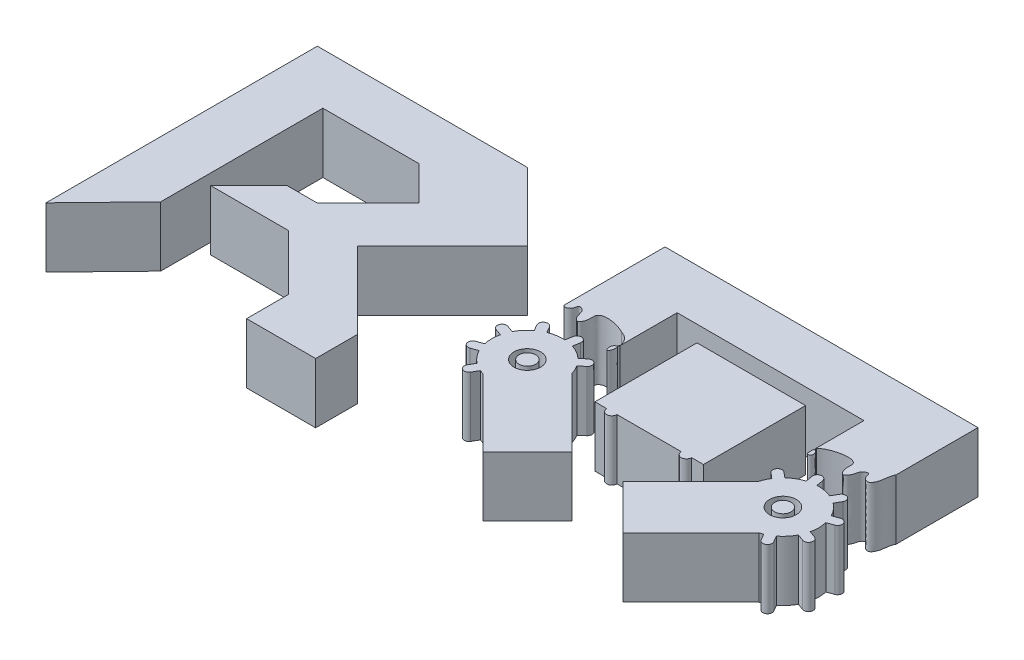
from build123d import *

# Parameters (mm, degrees)
BOSS_EXTRUDE1_DEPTH   = 10
BOSS_EXTRUDE1_2_DEPTH = 10
BOSS_EXTRUDE1_3_DEPTH = 10
BOSS_EXTRUDE1_4_DEPTH = 10
BOSS_EXTRUDE2_DEPTH   = 10
BOSS_EXTRUDE3_DEPTH   = 10
CUT_EXTRUDE1_DEPTH    = 10
BOSS_EXTRUDE5_DEPTH   = 10
BOSS_EXTRUDE6_DEPTH   = 10
CUT_EXTRUDE2_DEPTH    = 10
CUT_EXTRUDE3_DEPTH    = 10
BOSS_EXTRUDE7_DEPTH   = 10
BOSS_EXTRUDE7_2_DEPTH = 10
SKETCH12_R            = 2.214150269
SKETCH12_R_2          = 1.369548962
CUT_EXTRUDE4_DEPTH    = 10
SKETCH14_R            = 2.215
SKETCH14_R_2          = 1.37
CUT_EXTRUDE5_DEPTH    = 10


# Read off the part's stored shape, not the designer's step: Boss-Extrude3, Boss-Extrude5
with BuildPart() as part:
    # Sketch2 → Boss-Extrude1 (new body)
    with BuildSketch(Plane(origin=(0, 0, 0), x_dir=(1, 0, 0), z_dir=(0, 1, 0))):
        Polygon((-115.790051888, 9.714131272), (-80.790051888, 9.714131272), (-69.476343389, -1.599577227), (-83.618479013, -15.74171285), (-70.890556951, -28.469634912), (-70.890556951, -35.469634912), (-82.390556951, -35.469634912), (-82.390556951, -28.469634912), (-91.582945107, -19.277246756), (-104.582945107, -19.277246756), (-98.218984076, -12.913285726), (-93.218984076, -12.913285726), (-84.733702702, -4.428004351), (-90.390556951, 1.228849898), (-106.390556951, 1.228849898), (-106.390556951, -25.771150102), (-115.790051888, -35.469634912), align=None)
    extrude(amount=BOSS_EXTRUDE1_DEPTH)


with BuildPart() as body_2:
    # Sketch2 → Boss-Extrude1 2 (new body)
    with BuildSketch(Plane(origin=(0, 0, 0), x_dir=(1, 0, 0), z_dir=(0, 1, 0))):
        Polygon((-57.90275026, 9.714131272), (-57.90275026, -8.285868728), (-47.40275026, -8.285868728), (-47.40275026, 1.228849898), (-16.290051888, 1.228849898), (-16.290051888, -8.285868728), (-5.790051888, -8.285868728), (-5.790051888, 9.714131272), align=None)
    extrude(amount=BOSS_EXTRUDE1_2_DEPTH)

    # Sketch5 → Cut-Extrude1 (cut)
    with BuildSketch(Plane(origin=(0, 10, 0), x_dir=(1, 0, 0), z_dir=(0, 1, 0))):
        with BuildLine():
            Line((-16.290051888, -6.755516714), (-16.290051888, -8.285868728))
            Line((-16.290051888, -8.285868728), (-10.241204107, -8.285868728))
            add(Edge.make_bspline(
                [(-16.290051888, -6.755516714), (-15.086557725, -5.555520255), (-10.356708786, -4.539122293), (-11.112913844, -7.181843134), (-10.523034266, -8.273529149), (-10.241204107, -8.285868728)],
                knots=[0.102035434, 0.102035434, 0.102035434, 0.102035434, 0.361749054, 0.447111928, 0.509331686, 0.509331686, 0.509331686, 0.509331686], degree=3))
        make_face()
        with BuildLine():
            add(Edge.make_bspline(
                [(-10.217598425, -8.285868728), (-9.946495947, -8.274191318), (-9.288219588, -7.366460763), (-9.384527193, -6.374824783), (-8.082892219, -5.740250169), (-8.12682918, -6.978735964), (-7.012724749, -7.527990057), (-5.995137794, -6.005514134), (-6.254427822, -4.834059373), (-5.790051888, -3.907301253)],
                knots=[0.511063477, 0.511063477, 0.511063477, 0.511063477, 0.57055784, 0.643212518, 0.687880873, 0.734630546, 0.794154766, 0.839565267, 1, 1, 1, 1], degree=3))
            Line((-10.217598425, -8.285868728), (-5.790051888, -8.285868728))
            Line((-5.790051888, -8.285868728), (-5.790051888, -3.907301253))
        make_face()
    extrude(amount=-CUT_EXTRUDE1_DEPTH, mode=Mode.SUBTRACT)

    # Boss-Extrude5 outline → Boss-Extrude5 (add)
    with BuildSketch(Plane(origin=(0, 0, 0), x_dir=(1, 0, 0), z_dir=(0, 1, 0))):
        with BuildLine():
            Line((-16.290051888, -6.755516716), (-16.290051886, -6.718417146))
            add(Edge.make_bspline(
                [(-16.290051886, -6.718417146), (-16.29986079, -6.712492361), (-16.318900298, -6.706026413), (-16.300126293, -6.736175313), (-16.290051888, -6.755516716)],
                knots=[0.878523641, 0.878523641, 0.878523641, 0.878523641, 0.926519369, 1, 1, 1, 1], degree=3))
        make_face()
        with BuildLine():
            add(Edge.make_bspline(
                [(-16.290051889, -6.755516715), (-16.282897588, -6.748383207), (-16.27566002, -6.741265072), (-16.268340317, -6.734162607)],
                knots=[0.102035434, 0.102035434, 0.102035434, 0.102035434, 0.10357933, 0.10357933, 0.10357933, 0.10357933], degree=3))
            add(Edge.make_bspline(
                [(-16.290051889, -6.755516715), (-16.233648566, -6.863802945), (-16.217427394, -7.006707961), (-16.200258905, -7.001385989)],
                knots=[1, 1, 1, 1, 1.411394157, 1.411394157, 1.411394157, 1.411394157], degree=3))
            add(Edge.make_bspline(
                [(-16.19994332, -7.001270914), (-16.200048589, -7.00130913), (-16.200153786, -7.001347481), (-16.200258905, -7.001385989)],
                knots=[4.832e-06, 4.832e-06, 4.832e-06, 4.832e-06, 0.000153635, 0.000153635, 0.000153635, 0.000153635], degree=3))
            add(Edge.make_bspline(
                [(-16.19994332, -7.001270914), (-16.199939769, -7.001269997), (-16.182623673, -6.994039059), (-16.163283505, -6.828243372), (-16.264159765, -6.737651576), (-16.268340317, -6.734162607)],
                knots=[0.413915519, 0.413915519, 0.413915519, 0.413915519, 0.413995781, 0.828523269, 0.846360217, 0.846360217, 0.846360217, 0.846360217], degree=3))
        make_face()
    extrude(amount=BOSS_EXTRUDE5_DEPTH)

    # Sketch5<5> → Cut-Extrude2 (cut)
    with BuildSketch(Plane(origin=(0, 10, 0), x_dir=(1, 0, 0), z_dir=(0, 1, 0))):
        with BuildLine():
            add(Edge.make_bspline(
                [(-48.435448632, -8.285868728), (-46.372253699, -6.441223796), (-54.558235441, -3.877070611), (-53.612586676, -7.181843134), (-54.202466254, -8.273529149), (-54.484296413, -8.285868728)],
                knots=[0, 0, 0, 0, 0.361749054, 0.447111928, 0.509331686, 0.509331686, 0.509331686, 0.509331686], degree=3))
            Line((-54.484296413, -8.285868728), (-48.435448632, -8.285868728))
        make_face()
        with BuildLine():
            Line((-54.484296413, -8.285868728), (-54.507902095, -8.285868728))
            add(Edge.make_bspline(
                [(-54.484296413, -8.285868728), (-54.492140724, -8.286212181), (-54.500010709, -8.28620864), (-54.507902095, -8.285868728)],
                knots=[0.509331686, 0.509331686, 0.509331686, 0.509331686, 0.511063477, 0.511063477, 0.511063477, 0.511063477], degree=3))
        make_face()
        with BuildLine():
            Line((-57.90275026, -7.145951719), (-57.90275026, -8.285868728))
            Line((-57.90275026, -8.285868728), (-54.507902095, -8.285868728))
            add(Edge.make_bspline(
                [(-54.507902095, -8.285868728), (-54.779004573, -8.274191318), (-55.437280932, -7.366460763), (-55.340973326, -6.374824783), (-56.642608301, -5.740250169), (-56.598671339, -6.978735964), (-57.481588669, -7.41401469), (-57.84062135, -7.198771203), (-57.90275026, -7.145951719)],
                knots=[0.511063477, 0.511063477, 0.511063477, 0.511063477, 0.57055784, 0.643212518, 0.687880873, 0.734630546, 0.794154766, 0.808089335, 0.808089335, 0.808089335, 0.808089335], degree=3))
        make_face()
        with BuildLine():
            Line((-58.935448632, -3.907301253), (-58.935448632, -8.285868728))
            Line((-58.935448632, -8.285868728), (-57.90275026, -8.285868728))
            Line((-57.90275026, -8.285868728), (-57.90275026, -7.145951719))
            add(Edge.make_bspline(
                [(-57.90275026, -7.145951719), (-58.043089394, -7.026641069), (-58.712810244, -5.926213212), (-58.471072697, -4.834059373), (-58.935448632, -3.907301253)],
                knots=[0.808089335, 0.808089335, 0.808089335, 0.808089335, 0.839565267, 1, 1, 1, 1], degree=3))
        make_face()
    extrude(amount=-CUT_EXTRUDE2_DEPTH, mode=Mode.SUBTRACT)

    # Sketch8 → Cut-Extrude3 (cut)
    with BuildSketch(Plane(origin=(0, 10, 0), x_dir=(1, 0, 0), z_dir=(0, 1, 0))):
        with BuildLine():
            Line((-49.262061815, -6.169149348), (-49.262061815, -9.248498057))
            Line((-49.262061815, -9.248498057), (-47.40275026, -9.248498057))
            Line((-47.40275026, -9.248498057), (-47.40275026, -8.285868728))
            add(Edge.make_bspline(
                [(-49.262061815, -6.169149348), (-47.654011209, -6.67437326), (-47.40275026, -8.285868728)],
                knots=[0, 0, 0, 1, 1, 1], degree=2))
        make_face()
    extrude(amount=-CUT_EXTRUDE3_DEPTH, mode=Mode.SUBTRACT)


with BuildPart() as body_3:
    # Sketch2 → Boss-Extrude1 3 (new body)
    with BuildSketch(Plane(origin=(0, 0, 0), x_dir=(1, 0, 0), z_dir=(0, 1, 0))):
        with BuildLine():
            ThreePointArc((-54.827371462, -23.71048993), (-57.343333901, -13.769906289), (-47.40275026, -16.285868728))
            Line((-47.40275026, -16.285868728), (-36.089041761, -27.599577227))
            Line((-36.089041761, -27.599577227), (-43.513662963, -35.024198429))
            Line((-43.513662963, -35.024198429), (-54.827371462, -23.71048993))
        make_face()
    extrude(amount=BOSS_EXTRUDE1_3_DEPTH)



with BuildPart() as body_4:
    # Sketch2 → Boss-Extrude1 4 (new body)
    with BuildSketch(Plane(origin=(0, 0, 0), x_dir=(1, 0, 0), z_dir=(0, 1, 0))):
        with BuildLine():
            Line((-20.179139184, -35.024198429), (-8.865430685, -23.71048993))
            ThreePointArc((-8.865430685, -23.71048993), (-6.349468247, -13.769906289), (-16.290051888, -16.285868728))
            Line((-16.290051888, -16.285868728), (-27.603760387, -27.599577227))
            Line((-27.603760387, -27.599577227), (-20.179139184, -35.024198429))
        make_face()
    extrude(amount=BOSS_EXTRUDE1_4_DEPTH)


with BuildPart() as body_5:
    # Sketch4 → Boss-Extrude2 (new body)
    with BuildSketch(Plane(origin=(0, 0, 0), x_dir=(1, 0, 0), z_dir=(0, 1, 0))):
        with BuildLine():
            Line((-41.40275026, -1.464609204), (-23.32275026, -1.464609204))
            Line((-23.32275026, -1.464609204), (-23.32275026, -18.464609204))
            Line((-23.32275026, -18.464609204), (-25.298000573, -18.464609204))
            ThreePointArc((-25.298000573, -18.464609204), (-26.155032412, -19.321641043), (-27.012064251, -18.464609204))
            Line((-27.012064251, -18.464609204), (-37.713436269, -18.464609204))
            ThreePointArc((-37.713436269, -18.464609204), (-38.570468108, -19.321641043), (-39.427499947, -18.464609204))
            Line((-39.427499947, -18.464609204), (-41.40275026, -18.464609204))
            Line((-41.40275026, -18.464609204), (-41.40275026, -1.464609204))
        make_face()
    extrude(amount=BOSS_EXTRUDE2_DEPTH)


with BuildPart() as body_3_1:
    add(body_3.part)

    add(body_4.part)  # Boss-Extrude3 merges body 4
    # Boss-Extrude3 outline → Boss-Extrude3 (add)
    with BuildSketch(Plane(origin=(0, 0, 0), x_dir=(1, 0, 0), z_dir=(0, 1, 0))):
        with BuildLine():
            ThreePointArc((-12.373996633, -12.300892876), (-11.625121722, -12.115734802), (-10.858620701, -12.028709926))
            Line((-10.858620701, -12.028709926), (-11.067493613, -10.865812016))
            ThreePointArc((-11.067493613, -10.865812016), (-11.961273054, -10.244215525), (-12.582869546, -11.137994966))
            Line((-12.582869546, -11.137994966), (-12.373996633, -12.300892876))
        make_face()
        with BuildLine():
            ThreePointArc((-15.609067574, -14.791600394), (-15.154413425, -14.168393566), (-14.623178089, -13.609031284))
            Line((-14.623178089, -13.609031284), (-15.530680391, -12.852460722))
            ThreePointArc((-15.530680391, -12.852460722), (-16.614909688, -12.950800535), (-16.516569875, -14.035029832))
            Line((-16.516569875, -14.035029832), (-15.609067574, -14.791600394))
        make_face()
        with BuildLine():
            Line((-6.334769129, -23.741073981), (-6.928779973, -22.71974614))
            ThreePointArc((-6.928779973, -22.71974614), (-7.56916441, -23.14986812), (-8.259675503, -23.493803543))
            Line((-8.259675503, -23.493803543), (-7.665664658, -24.515131385))
            ThreePointArc((-7.665664658, -24.515131385), (-6.613188191, -24.793550448), (-6.334769129, -23.741073981))
        make_face()
        with BuildLine():
            Line((-3.629144236, -19.673346945), (-4.740679825, -19.272787238))
            ThreePointArc((-4.740679825, -19.272787238), (-4.954765684, -20.013910973), (-5.262650442, -20.721232768))
            Line((-5.262650442, -20.721232768), (-4.151114853, -21.121792474))
            ThreePointArc((-4.151114853, -21.121792474), (-3.16590678, -20.658555018), (-3.629144236, -19.673346945))
        make_face()
        with BuildLine():
            Line((-4.171199861, -14.818145096), (-5.280160338, -15.225779862))
            ThreePointArc((-5.280160338, -15.225779862), (-4.967774468, -15.931125319), (-4.748970189, -16.670869756))
            Line((-4.748970189, -16.670869756), (-3.640009712, -16.26323499))
            ThreePointArc((-3.640009712, -16.26323499), (-3.183059839, -15.275094968), (-4.171199861, -14.818145096))
        make_face()
        with BuildLine():
            Line((-7.707302151, -11.447271338), (-8.294792585, -12.47236374))
            ThreePointArc((-8.294792585, -12.47236374), (-7.602103805, -12.811891941), (-6.958991444, -13.237924377))
            Line((-6.958991444, -13.237924377), (-6.37150101, -12.212831975))
            ThreePointArc((-6.37150101, -12.212831975), (-6.656621262, -11.162151086), (-7.707302151, -11.447271338))
        make_face()
        with BuildLine():
            Line((-48.162121757, -12.852460722), (-49.069624058, -13.609031284))
            ThreePointArc((-49.069624058, -13.609031284), (-48.538388722, -14.168393566), (-48.083734574, -14.791600394))
            Line((-48.083734574, -14.791600394), (-47.176232272, -14.035029832))
            ThreePointArc((-47.176232272, -14.035029832), (-47.077892459, -12.950800534), (-48.162121757, -12.852460722))
        make_face()
        with BuildLine():
            Line((-52.625308535, -10.865812016), (-52.834181447, -12.028709926))
            ThreePointArc((-52.834181447, -12.028709926), (-52.067680425, -12.115734802), (-51.318805514, -12.300892877))
            Line((-51.318805514, -12.300892877), (-51.109932602, -11.137994966))
            ThreePointArc((-51.109932602, -11.137994966), (-51.731529094, -10.244215525), (-52.625308535, -10.865812016))
        make_face()
        with BuildLine():
            Line((-57.321301138, -12.212831975), (-56.733810703, -13.237924377))
            ThreePointArc((-56.733810703, -13.237924377), (-56.090698343, -12.81189194), (-55.398009563, -12.47236374))
            Line((-55.398009563, -12.47236374), (-55.985499997, -11.447271338))
            ThreePointArc((-55.985499997, -11.447271338), (-57.036180886, -11.162151086), (-57.321301138, -12.212831975))
        make_face()
        with BuildLine():
            Line((-60.052792436, -16.26323499), (-58.943831959, -16.670869756))
            ThreePointArc((-58.943831959, -16.670869756), (-58.72502768, -15.931125319), (-58.41264181, -15.225779862))
            Line((-58.41264181, -15.225779862), (-59.521602287, -14.818145096))
            ThreePointArc((-59.521602287, -14.818145096), (-60.509742309, -15.275094968), (-60.052792436, -16.26323499))
        make_face()
        with BuildLine():
            Line((-59.541687295, -21.121792474), (-58.430151706, -20.721232768))
            ThreePointArc((-58.430151706, -20.721232768), (-58.738036463, -20.013910973), (-58.952122323, -19.272787238))
            Line((-58.952122323, -19.272787238), (-60.063657911, -19.673346945))
            ThreePointArc((-60.063657911, -19.673346945), (-60.526895368, -20.658555018), (-59.541687295, -21.121792474))
        make_face()
        with BuildLine():
            Line((-56.027137489, -24.515131385), (-55.433126645, -23.493803543))
            ThreePointArc((-55.433126645, -23.493803543), (-56.123637738, -23.14986812), (-56.764022175, -22.71974614))
            Line((-56.764022175, -22.71974614), (-57.358033019, -23.741073981))
            ThreePointArc((-57.358033019, -23.741073981), (-57.079613956, -24.793550448), (-56.027137489, -24.515131385))
        make_face()
    extrude(amount=BOSS_EXTRUDE3_DEPTH)

    # Sketch12 → Cut-Extrude4 (cut)
    with BuildSketch(Plane(origin=(0, 10, 0), x_dir=(1, 0, 0), z_dir=(0, 1, 0))):
        with Locations(Location((-10.569950772, -17.990388815, 0), (0, 0, 270))):
            Circle(SKETCH12_R)
        with Locations(Location((-10.569950772, -17.990388815, 0), (0, 0, 270))):
            Circle(SKETCH12_R_2, mode=Mode.SUBTRACT)
    extrude(amount=-CUT_EXTRUDE4_DEPTH, mode=Mode.SUBTRACT)

    # Sketch14 → Cut-Extrude5 (cut)
    with BuildSketch(Plane(origin=(0, 10, 0), x_dir=(1, 0, 0), z_dir=(0, 1, 0))):
        with Locations(Location((-53.122851376, -17.990388815, 0), (0, 0, 270))):
            Circle(SKETCH14_R)
        with Locations(Location((-53.122851376, -17.990388815, 0), (0, 0, 270))):
            Circle(SKETCH14_R_2, mode=Mode.SUBTRACT)
    extrude(amount=-CUT_EXTRUDE5_DEPTH, mode=Mode.SUBTRACT)


with BuildPart() as body_5_2:
    # Sketch7 → Boss-Extrude6 (new body)
    with BuildSketch(Plane(origin=(0, 0, 0), x_dir=(1, 0, 0), z_dir=(0, 1, 0))):
        with BuildLine():
            add(Edge.make_bspline(
                [(-16.191635618, -7.094459759), (-16.335454857, -7.115471156), (-16.35777107, -7.728697871), (-16.260180897, -8.471388721), (-15.648118542, -8.164056737), (-15.619674978, -7.685938756), (-15.771297364, -7.298275318), (-16.099803188, -7.081043419), (-16.191635618, -7.094459759)],
                knots=[0, 0, 0, 0, 0.203671319, 0.42925475, 0.568279119, 0.707689132, 0.869950417, 1, 1, 1, 1], degree=3))
        make_face()
    extrude(amount=BOSS_EXTRUDE6_DEPTH)


with BuildPart() as body_6:
    # Sketch6<5> → Boss-Extrude7 (new body)
    with BuildSketch(Plane(origin=(0, 0, 0), x_dir=(1, 0, 0), z_dir=(0, 1, 0))):
        with BuildLine():
            add(Edge.make_bspline(
                [(-47.523232631, -8.5977764), (-47.390992372, -8.645769962), (-47.342814134, -9.312202567), (-47.845826592, -10.515323442), (-48.313475038, -8.978150537), (-47.646101291, -8.553184044), (-47.523232631, -8.5977764)],
                knots=[0, 0, 0, 0, 0.1869194, 0.474720501, 0.826327197, 1, 1, 1, 1], degree=3))
        make_face()
    extrude(amount=BOSS_EXTRUDE7_DEPTH)


with BuildPart() as body_7:
    # Sketch6<5> → Boss-Extrude7 2 (new body)
    with BuildSketch(Plane(origin=(0, 0, 0), x_dir=(1, 0, 0), z_dir=(0, 1, 0))):
        with BuildLine():
            add(Edge.make_bspline(
                [(-47.425778183, -8.323083428), (-47.482538195, -8.43205445), (-47.514694907, -8.720297524), (-47.556131514, -8.365077734), (-47.389202283, -8.261183663), (-47.415703777, -8.303742024), (-47.425778183, -8.323083428)],
                knots=[0, 0, 0, 0, 0.413995781, 0.828523269, 0.926519369, 1, 1, 1, 1], degree=3))
        make_face()
    extrude(amount=BOSS_EXTRUDE7_2_DEPTH)


solid = Compound([part.part, body_2.part, body_5.part, body_3_1.part, body_5_2.part, body_6.part, body_7.part])
